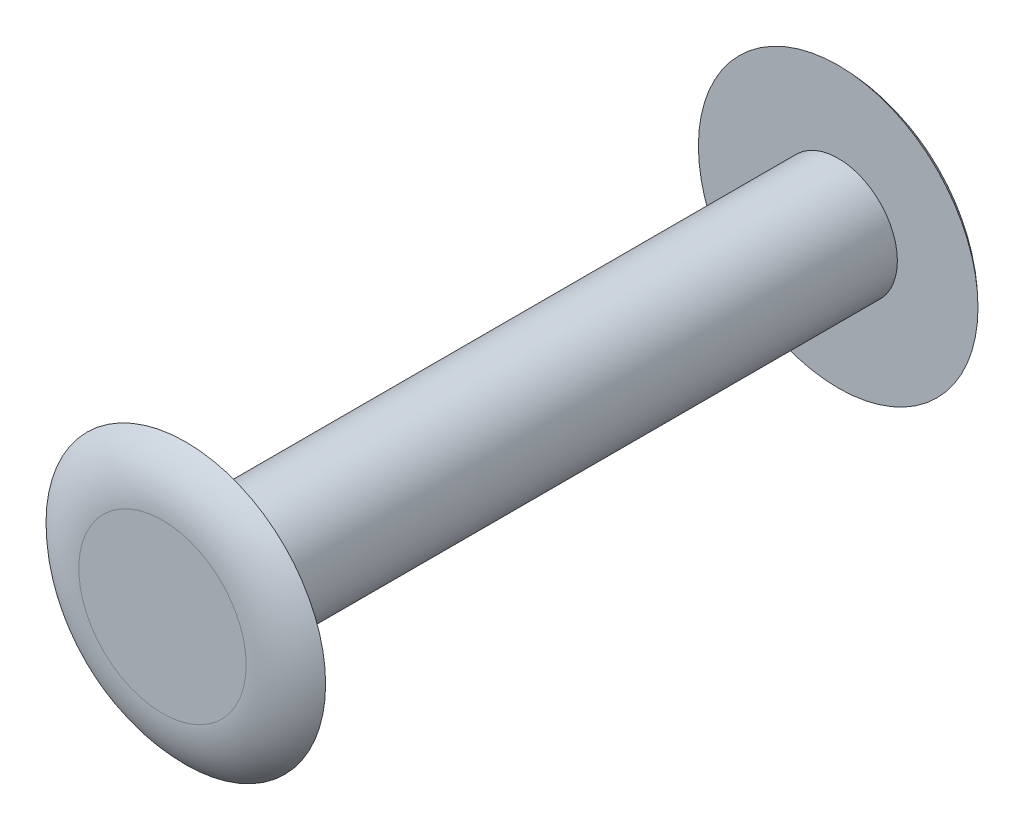
from build123d import *

# Parameters (mm, degrees)
SKETCH1_R           = 6.35
BOSS_EXTRUDE1_DEPTH = 70
SKETCH2_R           = 15
BOSS_EXTRUDE2_DEPTH = 2.5
BOSS_EXTRUDE3_START = 2.5
SKETCH3_R           = 15
BOSS_EXTRUDE3_DEPTH = 2.5
FILLET1_R           = 8.5


with BuildPart() as part:
    # Sketch1 → Boss-Extrude1 (new body)
    with BuildSketch(Plane.XY):
        Circle(SKETCH1_R)
    extrude(amount=BOSS_EXTRUDE1_DEPTH)

    # Sketch2 → Boss-Extrude2 (add)
    with BuildSketch(Plane(origin=(0, 0, 0), x_dir=(-1, 0, 0), z_dir=(0, 0, -1))):
        Circle(SKETCH2_R)
    extrude(amount=BOSS_EXTRUDE2_DEPTH)

    # Sketch3 → Boss-Extrude3 (add)
    with BuildSketch(Plane.XY.offset(70).offset(BOSS_EXTRUDE3_START)):
        with Locations(Location((0, 0, 0), (0, 0, 180))):
            Circle(SKETCH3_R)
    extrude(amount=-BOSS_EXTRUDE3_DEPTH)

    # Fillet1
    # the kernel refuses this fillet: 8.5 mm, written as the material it takes off along each edge
    with BuildSketch(Plane(origin=(0, 0, 72.5), x_dir=(-1, 0, 0), z_dir=(0, 1, 0))) as fillet1_piece_1:
        with BuildLine():
            CenterArc((8.979202711, -8.5), FILLET1_R, 44.900872156, 45.099127844)
            Line((8.979202711, 0), (8.979202711, 0.17))
            Line((8.979202711, 0.17), (15, 0.17))
            Line((15, 0.17), (15.17, 0))
            ThreePointArc((15.17, 0), (15.17, -1.25), (15.120415946, -2.38))
            Line((15.120415946, -2.38), (15, -2.5))
        make_face()
    revolve(axis=Axis((0, 0, 72.5), (0, 0, 1)), mode=Mode.SUBTRACT)
    with BuildSketch(Plane(origin=(0, 0, -2.5), x_dir=(-1, 0, 0), z_dir=(0, -1, 0))) as fillet1_piece_2:
        with BuildLine():
            CenterArc((8.979202711, -8.5), FILLET1_R, 44.900872156, 45.099127844)
            Line((8.979202711, 0), (8.979202711, 0.17))
            Line((8.979202711, 0.17), (15, 0.17))
            Line((15, 0.17), (15.17, 0))
            ThreePointArc((15.17, 0), (15.17, -1.25), (15.120415946, -2.38))
            Line((15.120415946, -2.38), (15, -2.5))
        make_face()
    revolve(axis=Axis((0, 0, -2.5), (0, 0, -1)), mode=Mode.SUBTRACT)


solid = part.part
